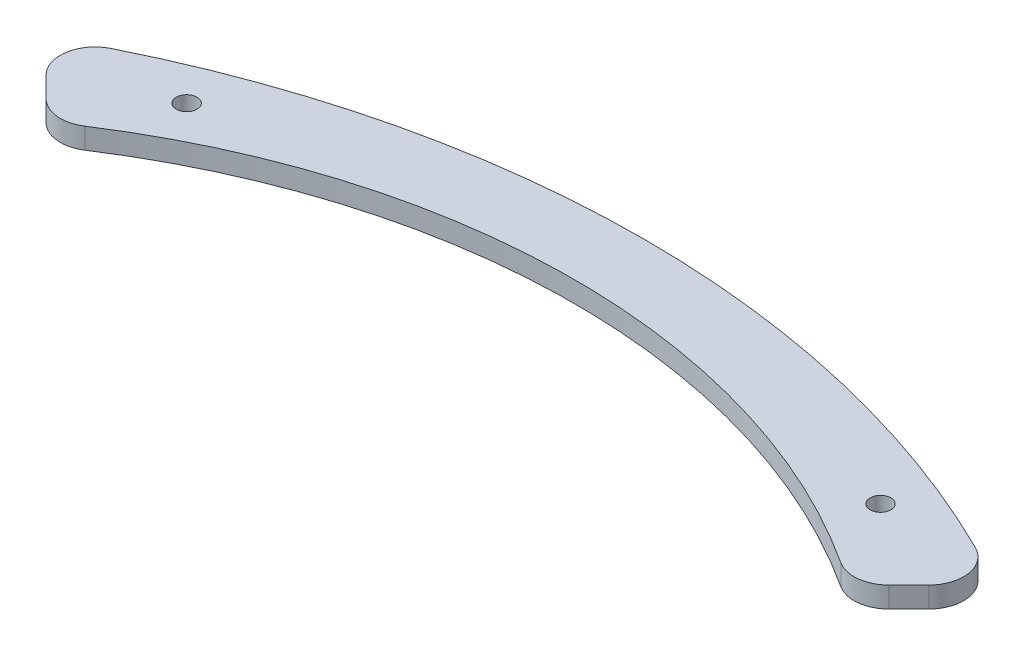
from build123d import *

# Parameters (mm, degrees)
BOSS_EXTRUDE1_DEPTH = 3
FILLET1_R           = 5
CUT_EXTRUDE1_REACH  = 156.417
SKETCH2_R           = 1.5


with BuildPart() as part:
    # Sketch1 → Boss-Extrude1 (new body)
    with BuildSketch(Plane(origin=(0, 0, 0), x_dir=(1, 0, 0), z_dir=(0, 1, 0))):
        with BuildLine():
            Line((-68.408481347, 122.148596717), (-57.801879629, 111.541994999))
            ThreePointArc((-57.801879629, 111.541994999), (0, 129.939649987), (57.801879629, 111.541994999))
            Line((57.801879629, 111.541994999), (68.408481347, 122.148596717))
            ThreePointArc((68.408481347, 122.148596717), (0, 140), (-68.408481347, 122.148596717))
        make_face()
    extrude(amount=BOSS_EXTRUDE1_DEPTH)

    # Fillet1
    fillet1_edges = [part.edges().sort_by_distance(p)[0] for p in [
        (68.408481347, 1.5, -122.148596717),
        (57.801879629, 1.5, -111.541994999),
        (-68.408481347, 1.5, -122.148596717),
        (-57.801879629, 1.5, -111.541994999),
    ]]
    fillet(fillet1_edges, radius=FILLET1_R)

    # Sketch2 → Cut-Extrude1 (cut, up to next)
    with BuildSketch(Plane(origin=(0, 3, 0), x_dir=(1, 0, 0), z_dir=(0, 1, 0)), mode=Mode.PRIVATE) as cut_extrude1_sk1:
        with Locations((-50, 124)):
            Circle(SKETCH2_R)
    cut_extrude1_tool1 = extrude(cut_extrude1_sk1.sketch, amount=-CUT_EXTRUDE1_REACH, mode=Mode.PRIVATE) & part.part
    # Sketch2 → Cut-Extrude1 (cut, up to next)
    with BuildSketch(Plane(origin=(0, 3, 0), x_dir=(1, 0, 0), z_dir=(0, 1, 0)), mode=Mode.PRIVATE) as cut_extrude1_sk2:
        with Locations((50, 124)):
            Circle(SKETCH2_R)
    cut_extrude1_tool2 = extrude(cut_extrude1_sk2.sketch, amount=-CUT_EXTRUDE1_REACH, mode=Mode.PRIVATE) & part.part
    add(cut_extrude1_tool1.solids().sort_by_distance((-50, 3, -124))[0], mode=Mode.SUBTRACT)
    add(cut_extrude1_tool2.solids().sort_by_distance((50, 3, -124))[0], mode=Mode.SUBTRACT)


solid = part.part
